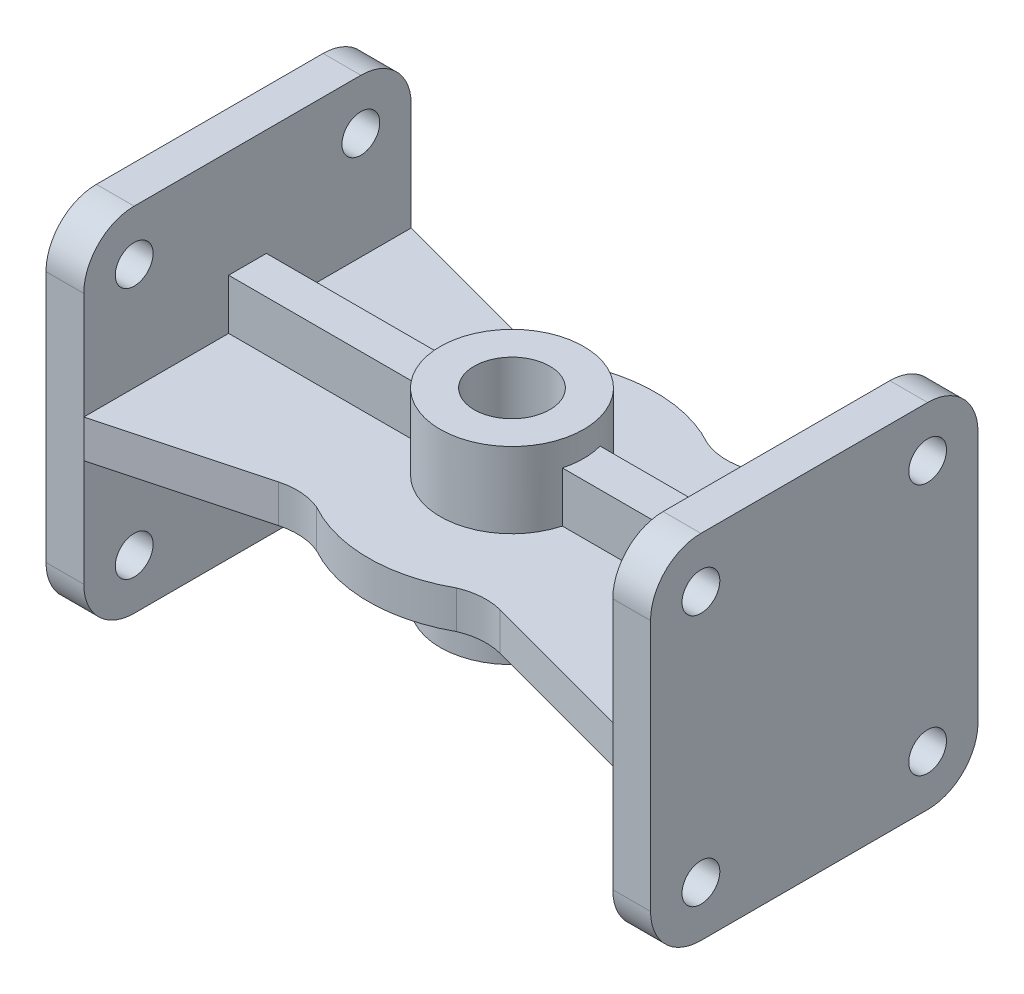
from build123d import *

# Parameters (mm, degrees)
BOSS_EXTRUDE1_DEPTH   = 7.5
CUT_EXTRUDE1_DEPTH    = 124.718430317
BOSS_EXTRUDE2_START   = 37.5
BOSS_EXTRUDE2_DEPTH   = 37.5
BOSS_EXTRUDE3_START   = 27.5
BOSS_EXTRUDE3_DEPTH   = 27.5
SKETCH4_R             = 7.5
BOSS_EXTRUDE4_DEPTH   = 15
MIRROR1_DEPTH         = 27.5
MIRROR1_2_DEPTH       = 7.5
MIRROR1_START         = 27.5
MIRROR1_3_OUTLINE_W   = 15
MIRROR1_3_OUTLINE_H   = 130
MIRROR1_3_OUTLINE_H_2 = 65
MIRROR1_3_DEPTH       = 14.9999999
MIRROR1_4_DEPTH       = 10
MIRROR1_START_2       = -120
MIRROR1_5_OUTLINE_R   = 7.5
MIRROR1_5_DEPTH       = 15
MIRROR1_START_3       = 105
MIRROR1_6_OUTLINE_R   = 7.5
MIRROR1_6_DEPTH       = 15


with BuildPart() as part:
    # Sketch1 → Boss-Extrude1 (new body)
    with BuildSketch(Plane(origin=(0, 0, 0), x_dir=(1, 0, 0), z_dir=(0, 1, 0))):
        with BuildLine():
            Line((43.979733232, 48.649668798), (105, 65))
            Line((105, 65), (105, 0))
            Line((105, 0), (0, 0))
            Line((0, 0), (0, 57))
            ThreePointArc((0, 57), (14.366743308, 55.159737914), (27.805817387, 49.757778482))
            ThreePointArc((27.805817387, 49.757778482), (35.800459234, 47.856282629), (43.979733232, 48.649668798))
        make_face()
    extrude(amount=BOSS_EXTRUDE1_DEPTH)

    # Sketch2 → Cut-Extrude1 (cut, through all)
    with BuildSketch(Plane(origin=(0, 7.5, 0), x_dir=(1, 0, 0), z_dir=(0, 1, 0))):
        with BuildLine():
            Line((0, 15), (0, 0))
            Line((0, 0), (15, 0))
            ThreePointArc((15, 0), (10.606601718, 10.606601718), (0, 15))
        make_face()
    extrude(amount=-CUT_EXTRUDE1_DEPTH, mode=Mode.SUBTRACT)

    # Sketch3 → Boss-Extrude2 (add)
    with BuildSketch(Plane(origin=(0, 0, 0), x_dir=(1, 0, 0), z_dir=(0, 1, 0)).offset(BOSS_EXTRUDE2_START)):
        with BuildLine():
            ThreePointArc((28.5, 0), (28.247747201, 3.783487555), (27.49545417, 7.5))
            ThreePointArc((27.49545417, 7.5), (17.298843892, 22.649503306), (0, 28.5))
            Line((0, 28.5), (0, 15))
            ThreePointArc((0, 15), (10.606601718, 10.606601718), (15, 0))
            Line((15, 0), (28.5, 0))
        make_face()
    extrude(amount=-BOSS_EXTRUDE2_DEPTH)

    # Sketch3<4> → Boss-Extrude3 (add)
    with BuildSketch(Plane(origin=(0, 0, 0), x_dir=(1, 0, 0), z_dir=(0, 1, 0)).offset(BOSS_EXTRUDE3_START)):
        with BuildLine():
            Line((105, 7.5), (27.49545417, 7.5))
            ThreePointArc((27.49545417, 7.5), (28.247747201, 3.783487555), (28.5, 0))
            Line((28.5, 0), (105, 0))
            Line((105, 0), (105, 7.5))
        make_face()
    extrude(amount=-BOSS_EXTRUDE3_DEPTH)

    # Sketch4 → Boss-Extrude4 (add)
    with BuildSketch(Plane(origin=(105, 0, 0), x_dir=(0, 0, -1), z_dir=(1, 0, 0))):
        with BuildLine():
            Line((0, 0), (65, 0))
            Line((65, 0), (65, 50))
            ThreePointArc((65, 50), (59.142135624, 64.142135624), (45, 70))
            Line((45, 70), (0, 70))
            Line((0, 70), (0, 0))
        make_face()
        with Locations((45, 50)):
            Circle(SKETCH4_R, mode=Mode.SUBTRACT)
    extrude(amount=BOSS_EXTRUDE4_DEPTH)

    # Mirror1: read off the stored shape, not the designer's step
    # Mirror1 outline → Mirror1 (add)
    with BuildSketch(Plane(origin=(0, 0, 0), x_dir=(1, 0, 0), z_dir=(0, 1, 0))):
        with BuildLine():
            Line((0, 15), (0, 28.5))
            ThreePointArc((0, 28.5), (-17.298843892, 22.649503306), (-27.49545417, 7.5))
            Line((-27.49545417, 7.5), (-105, 7.5))
            Line((-105, 7.5), (-105, 65))
            Line((-105, 65), (-120, 65))
            Line((-120, 65), (-120, -65))
            Line((-120, -65), (-105, -65))
            Line((-105, -65), (-105, -7.5))
            Line((-105, -7.5), (-27.49545417, -7.5))
            ThreePointArc((-27.49545417, -7.5), (0, -28.5), (27.49545417, -7.5))
            Line((27.49545417, -7.5), (105, -7.5))
            Line((105, -7.5), (105, -65))
            Line((105, -65), (120, -65))
            Line((120, -65), (120, 0))
            Line((120, 0), (15, 0))
            ThreePointArc((15, 0), (-10.606601718, -10.606601718), (0, 15))
        make_face()
    extrude(amount=MIRROR1_DEPTH)

    # Mirror1 2 outline → Mirror1 2 (add)
    with BuildSketch(Plane(origin=(0, 0, 0), x_dir=(1, 0, 0), z_dir=(0, 1, 0))):
        with BuildLine():
            ThreePointArc((0, 57), (-14.366743308, 55.159737914), (-27.805817387, 49.757778482))
            ThreePointArc((-27.805817387, 49.757778482), (-35.800459234, 47.856282629), (-43.979733232, 48.649668798))
            Line((-43.979733232, 48.649668798), (-105, 65))
            Line((-105, 65), (-105, 7.5))
            Line((-105, 7.5), (-27.49545417, 7.5))
            ThreePointArc((-27.49545417, 7.5), (-17.298843892, 22.649503306), (0, 28.5))
            Line((0, 28.5), (0, 57))
        make_face()
        with BuildLine():
            Line((105, -7.5), (27.49545417, -7.5))
            ThreePointArc((27.49545417, -7.5), (0, -28.5), (-27.49545417, -7.5))
            Line((-27.49545417, -7.5), (-105, -7.5))
            Line((-105, -7.5), (-105, -65))
            Line((-105, -65), (-43.979733232, -48.649668798))
            ThreePointArc((-43.979733232, -48.649668798), (-35.800459234, -47.856282629), (-27.805817387, -49.757778482))
            ThreePointArc((-27.805817387, -49.757778482), (0, -57), (27.805817387, -49.757778482))
            ThreePointArc((27.805817387, -49.757778482), (35.800459234, -47.856282629), (43.979733232, -48.649668798))
            Line((43.979733232, -48.649668798), (105, -65))
            Line((105, -65), (105, -7.5))
        make_face()
    extrude(amount=MIRROR1_2_DEPTH)

    # Mirror1 3 outline → Mirror1 3 (add)
    with BuildSketch(Plane(origin=(0, 0, 0), x_dir=(1, 0, 0), z_dir=(0, 1, 0)).offset(MIRROR1_START)):
        with Locations((-112.5, 0)):
            Rectangle(MIRROR1_3_OUTLINE_W, MIRROR1_3_OUTLINE_H)
        with Locations((112.5, -32.5)):
            Rectangle(MIRROR1_3_OUTLINE_W, MIRROR1_3_OUTLINE_H_2)
    extrude(amount=MIRROR1_3_DEPTH)

    # Mirror1 4 outline → Mirror1 4 (add)
    with BuildSketch(Plane(origin=(0, 0, 0), x_dir=(1, 0, 0), z_dir=(0, 1, 0)).offset(MIRROR1_START)):
        with BuildLine():
            Line((0, 15), (0, 28.5))
            ThreePointArc((0, 28.5), (-20.152543264, -20.152543264), (28.5, 0))
            Line((28.5, 0), (15, 0))
            ThreePointArc((15, 0), (-10.606601718, -10.606601718), (0, 15))
        make_face()
    extrude(amount=MIRROR1_4_DEPTH)

    # Mirror1 5 outline → Mirror1 5 (add)
    with BuildSketch(Plane.YZ.offset(MIRROR1_START_2)):
        with BuildLine():
            Line((7.5, -7.5), (7.5, -65))
            Line((7.5, -65), (50, -65))
            ThreePointArc((50, -65), (64.142135624, -59.142135624), (70, -45))
            Line((70, -45), (70, 45))
            ThreePointArc((70, 45), (64.142135624, 59.142135624), (50, 65))
            Line((50, 65), (7.5, 65))
            Line((7.5, 65), (7.5, 7.5))
            Line((7.5, 7.5), (27.5, 7.5))
            Line((27.5, 7.5), (27.5, -7.5))
            Line((27.5, -7.5), (7.5, -7.5))
        make_face()
        with Locations((50, -45)):
            Circle(MIRROR1_5_OUTLINE_R, mode=Mode.SUBTRACT)
        with Locations((50, 45)):
            Circle(MIRROR1_5_OUTLINE_R, mode=Mode.SUBTRACT)
    extrude(amount=MIRROR1_5_DEPTH)

    # Mirror1 6 outline → Mirror1 6 (add)
    with BuildSketch(Plane.YZ.offset(MIRROR1_START_3)):
        with BuildLine():
            Line((7.5, -7.5), (7.5, -65))
            Line((7.5, -65), (50, -65))
            ThreePointArc((50, -65), (64.142135624, -59.142135624), (70, -45))
            Line((70, -45), (70, 45))
            ThreePointArc((70, 45), (64.142135624, 59.142135624), (50, 65))
            Line((50, 65), (7.5, 65))
            Line((7.5, 65), (7.5, 7.5))
            Line((7.5, 7.5), (27.5, 7.5))
            Line((27.5, 7.5), (27.5, -7.5))
            Line((27.5, -7.5), (7.5, -7.5))
        make_face()
        with Locations((50, -45)):
            Circle(MIRROR1_6_OUTLINE_R, mode=Mode.SUBTRACT)
        with Locations((50, 45)):
            Circle(MIRROR1_6_OUTLINE_R, mode=Mode.SUBTRACT)
    extrude(amount=MIRROR1_6_DEPTH)

    # Mirror2: part across face


with BuildPart() as part_1:
    add(part.part)
    add(part.part.mirror(Plane(origin=(0, 0, 0), x_dir=(0, 0, 1), z_dir=(0, -1, 0))))


solid = part_1.part
